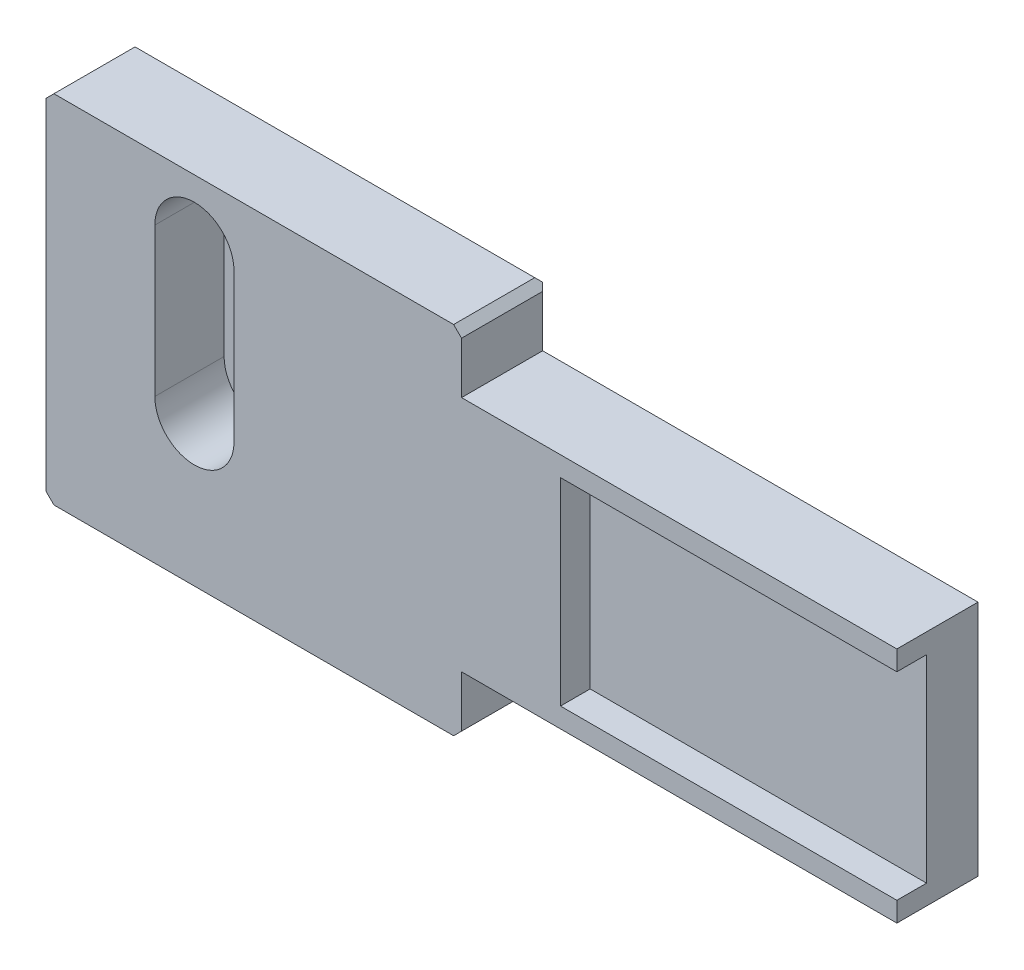
from build123d import *

# Parameters (mm, degrees)
SKETCH1_W           = 43
SKETCH1_H           = 18
BOSS_EXTRUDE1_DEPTH = 4.5
SKETCH2_W           = 22
SKETCH2_H           = 3
CUT_EXTRUDE1_DEPTH  = 47.832147079
SKETCH3_W           = 22
SKETCH3_H           = 3
CUT_EXTRUDE2_DEPTH  = 47.832147079
CUT_EXTRUDE3_DEPTH  = 3.5
CUT_EXTRUDE4_DEPTH  = 47.832147079
SKETCH6_W           = 1.5
SKETCH6_H           = 10
CUT_EXTRUDE5_DEPTH  = 17
CHAMFER1_SIZE       = 0.4
CHAMFER2_SIZE       = 0.4


with BuildPart() as part:
    # Sketch1 → Boss-Extrude1 (new body)
    with BuildSketch(Plane(origin=(0, 0, 0), x_dir=(-1, 0, 0), z_dir=(0, 0, -1))):
        with Locations((-21.5, 9)):
            Rectangle(SKETCH1_W, SKETCH1_H)
    extrude(amount=-BOSS_EXTRUDE1_DEPTH)

    # Sketch2 → Cut-Extrude1 (cut, through all)
    with BuildSketch(Plane.XY.offset(4.5)):
        with Locations((32, 1.5)):
            Rectangle(SKETCH2_W, SKETCH2_H)
    extrude(amount=-CUT_EXTRUDE1_DEPTH, mode=Mode.SUBTRACT)

    # Sketch3 → Cut-Extrude2 (cut, through all)
    with BuildSketch(Plane.XY.offset(4.5)):
        with Locations((32, 16.5)):
            Rectangle(SKETCH3_W, SKETCH3_H)
    extrude(amount=-CUT_EXTRUDE2_DEPTH, mode=Mode.SUBTRACT)

    # Sketch4 → Cut-Extrude3 (cut)
    with BuildSketch(Plane.XY.offset(4.5)):
        with BuildLine():
            Line((9.5, 14.8), (9.5, 7.3))
            ThreePointArc((9.5, 7.3), (7.5, 5.3), (5.5, 7.3))
            Line((5.5, 7.3), (5.5, 14.8))
            ThreePointArc((5.5, 14.8), (7.5, 16.8), (9.5, 14.8))
        make_face()
    extrude(amount=-CUT_EXTRUDE3_DEPTH, mode=Mode.SUBTRACT)

    # Sketch5 → Cut-Extrude4 (cut, through all)
    with BuildSketch(Plane(origin=(0, 0, 0), x_dir=(-1, 0, 0), z_dir=(0, 0, -1))):
        with BuildLine():
            Line((-6.300000004, 14.79990089), (-6.300621502, 7.27497794))
            ThreePointArc((-6.300621502, 7.27497794), (-7.500720608, 6.075077054), (-8.700621494, 7.27517616))
            Line((-8.700621494, 7.27517616), (-8.699999996, 14.80009911))
            ThreePointArc((-8.699999996, 14.80009911), (-7.49990089, 15.999999996), (-6.300000004, 14.79990089))
        make_face()
    extrude(amount=-CUT_EXTRUDE4_DEPTH, mode=Mode.SUBTRACT)

    # Sketch6 → Cut-Extrude5 (cut)
    with BuildSketch(Plane(origin=(43, 0, 0), x_dir=(0, 0, -1), z_dir=(1, 0, 0))):
        with Locations((-3.75, 9)):
            Rectangle(SKETCH6_W, SKETCH6_H)
    extrude(amount=-CUT_EXTRUDE5_DEPTH, mode=Mode.SUBTRACT)

    # Chamfer1
    chamfer1_edges = [part.edges().sort_by_distance(p)[0] for p in [
        (10.5, 18, 0),
        (0, 9, 0),
        (10.5, 0, 0),
        (21, 1.5, 0),
        (32, 3, 0),
        (43, 9, 0),
        (32, 15, 0),
        (21, 16.5, 0),
        (8.700310745, 11.037637635, 0),
        (7.500720608, 6.075077054, 0),
        (6.300310753, 11.037439415, 0),
        (7.49990089, 15.999999996, 0),
    ]]
    chamfer(chamfer1_edges, length=CHAMFER1_SIZE)

    # Chamfer2
    chamfer2_edges = [part.edges().sort_by_distance(p)[0] for p in [
        (21, 0, 2.45),
        (0, 0, 2.45),
        (0, 18, 2.45),
        (21, 18, 2.45),
    ]]
    chamfer(chamfer2_edges, length=CHAMFER2_SIZE)


solid = part.part
